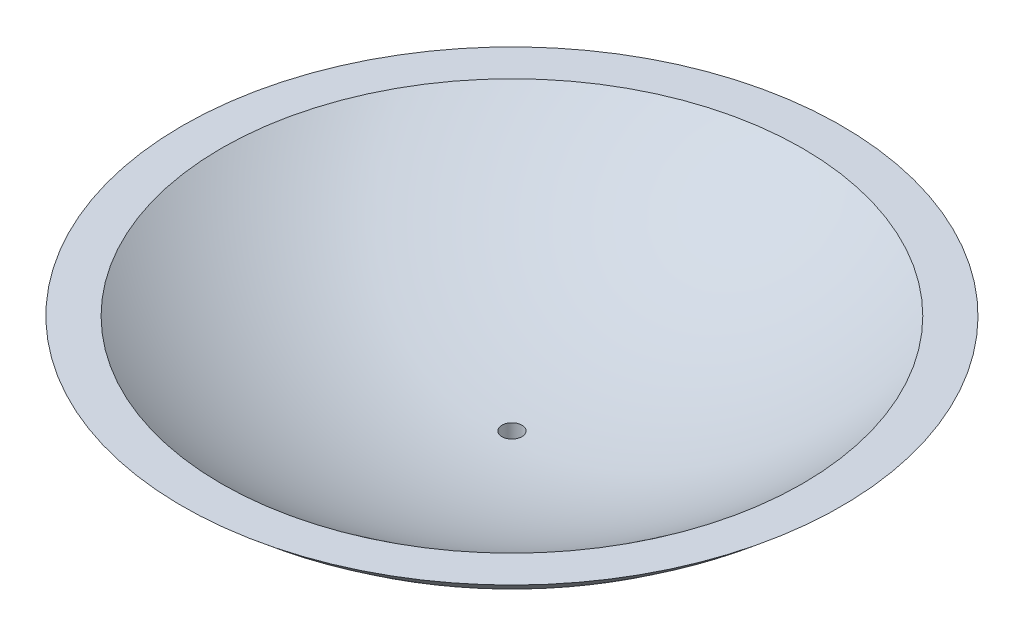
from build123d import *

# Parameters (mm, degrees)
F_1_4_20_TAPPED_HOLE1_D     = 5.1054
F_1_4_20_TAPPED_HOLE1_DEPTH = 12.7
F_1_4_20_TAPPED_HOLE1_TIP   = 1.533816902


with BuildPart() as part:
    # Sketch1 → Revolve1 (revolve)
    with BuildSketch(Plane.XY):
        with BuildLine():
            Line((0, 0), (-12.7, 0))
            Line((-12.7, 0), (-12.7, 6.35))
            ThreePointArc((-12.7, 6.35), (-50.792316312, 16.312628726), (-84.002604126, 37.463404513))
            Line((-84.002604126, 37.463404513), (-74.053089065, 37.463404513))
            ThreePointArc((-74.053089065, 37.463404513), (-39.144028919, 18.589929714), (0, 12.063404513))
            Line((0, 12.063404513), (0, 0))
        make_face()
    revolve(axis=Axis((0, 25.810843339, 0), (0, -1, 0)))

    # 1/4-20 Tapped Hole1
    with Locations(Plane(origin=(0, 0, 0), x_dir=(-1, 0, 0), z_dir=(0, -1, 0))):
        with Locations((0, 0)):
            Hole(F_1_4_20_TAPPED_HOLE1_D / 2, depth=F_1_4_20_TAPPED_HOLE1_DEPTH)
            with Locations((0, 0, -(F_1_4_20_TAPPED_HOLE1_DEPTH + F_1_4_20_TAPPED_HOLE1_TIP / 2))):  # 118° drill point
                Cone(0, F_1_4_20_TAPPED_HOLE1_D / 2, F_1_4_20_TAPPED_HOLE1_TIP, mode=Mode.SUBTRACT)


solid = part.part
